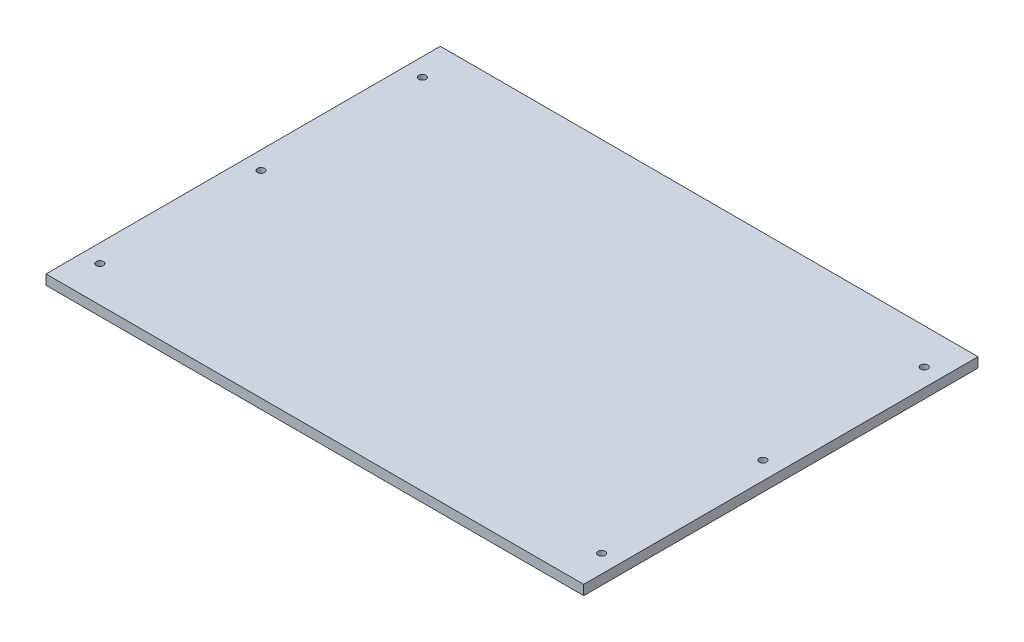
from build123d import *

# Parameters (mm, degrees)
SKETCH2_W           = 300
SKETCH2_H           = 5.5
BOSS_EXTRUDE1_DEPTH = 110
SKETCH3_R           = 2
CUT_EXTRUDE1_DEPTH  = 320.578237682


with BuildPart() as part:
    # Sketch2 → Boss-Extrude1 (new, symmetric)
    with BuildSketch(Plane.XY):
        with Locations((150, -2.75)):
            Rectangle(SKETCH2_W, SKETCH2_H)
    extrude(amount=BOSS_EXTRUDE1_DEPTH, both=True)

    # Sketch3 → Cut-Extrude1 (cut, through all)
    with BuildSketch(Plane.XZ.offset(5.5)):
        with Locations((10, 90)):
            Circle(SKETCH3_R)
        with Locations((10, -90)):
            Circle(SKETCH3_R)
        with Locations((10, 0)):
            Circle(SKETCH3_R)
        with Locations((290, -90)):
            Circle(SKETCH3_R)
        with Locations((290, 0)):
            Circle(SKETCH3_R)
        with Locations((290, 90)):
            Circle(SKETCH3_R)
    extrude(amount=-CUT_EXTRUDE1_DEPTH, mode=Mode.SUBTRACT)


solid = part.part
